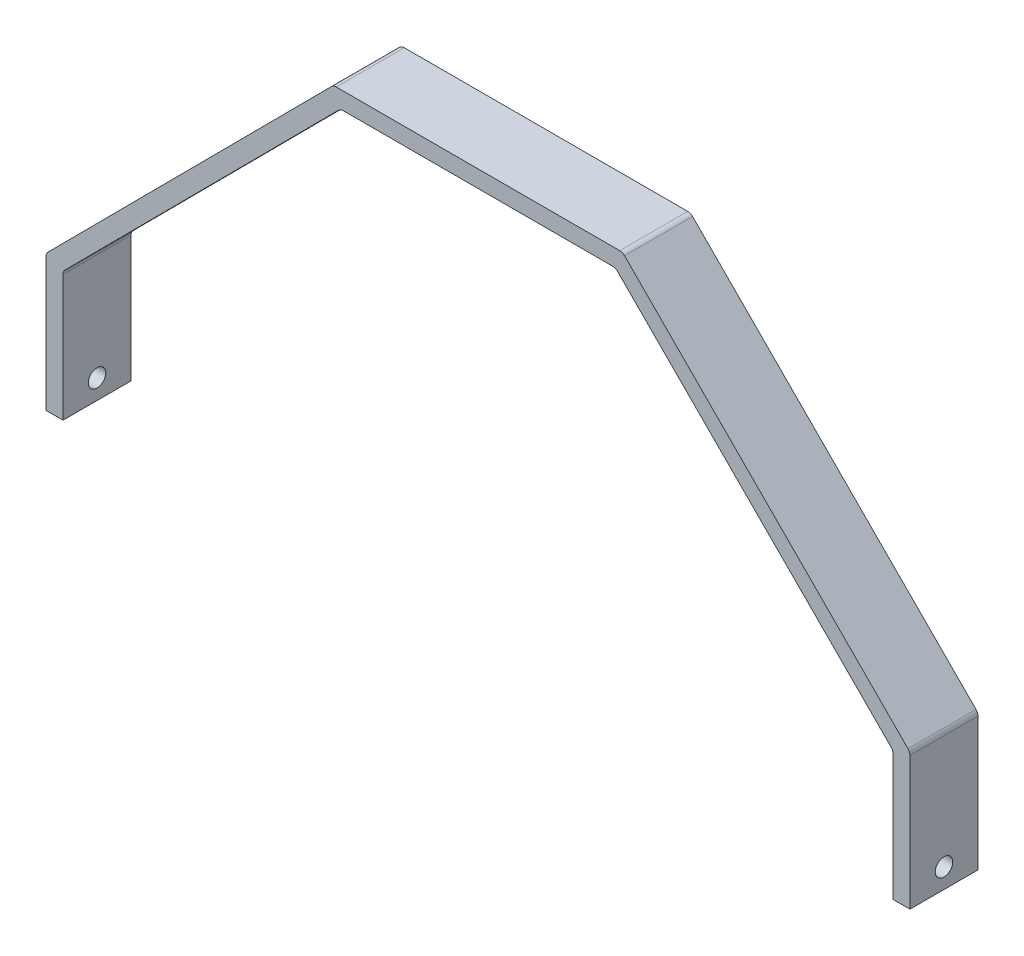
from build123d import *

# Parameters (mm, degrees)
BOSS_EXTRUDE1_DEPTH = 20
FILLET1_R           = 2
SKETCH2_R           = 2.574841431
CUT_EXTRUDE1_DEPTH  = 284.797462991


with BuildPart() as part:
    # Sketch1 → Boss-Extrude1 (new body)
    with BuildSketch(Plane.XY):
        Polygon((42.5, 0), (-42.5, 0), (-127, -85), (-127, -125), (-122, -125), (-122, -87.062433188), (-40.420287007, -5), (40.420287007, -5), (122, -87.062433188), (122, -125), (127, -125), (127, -85), align=None)
    extrude(amount=BOSS_EXTRUDE1_DEPTH)

    # Fillet1
    fillet1_edges = [part.edges().sort_by_distance(p)[0] for p in [
        (122, -87.062433188, 10),
        (40.420287007, -5, 10),
        (-40.420287007, -5, 10),
        (-122, -87.062433188, 10),
        (-127, -85, 10),
        (127, -85, 10),
        (-42.5, 0, 10),
        (42.5, 0, 10),
    ]]
    fillet(fillet1_edges, radius=FILLET1_R)

    # Sketch2 → Cut-Extrude1 (cut, through all)
    with BuildSketch(Plane.ZY.offset(127)):
        with Locations((10, -119.231003563)):
            Circle(SKETCH2_R)
    extrude(amount=-CUT_EXTRUDE1_DEPTH, mode=Mode.SUBTRACT)


solid = part.part
